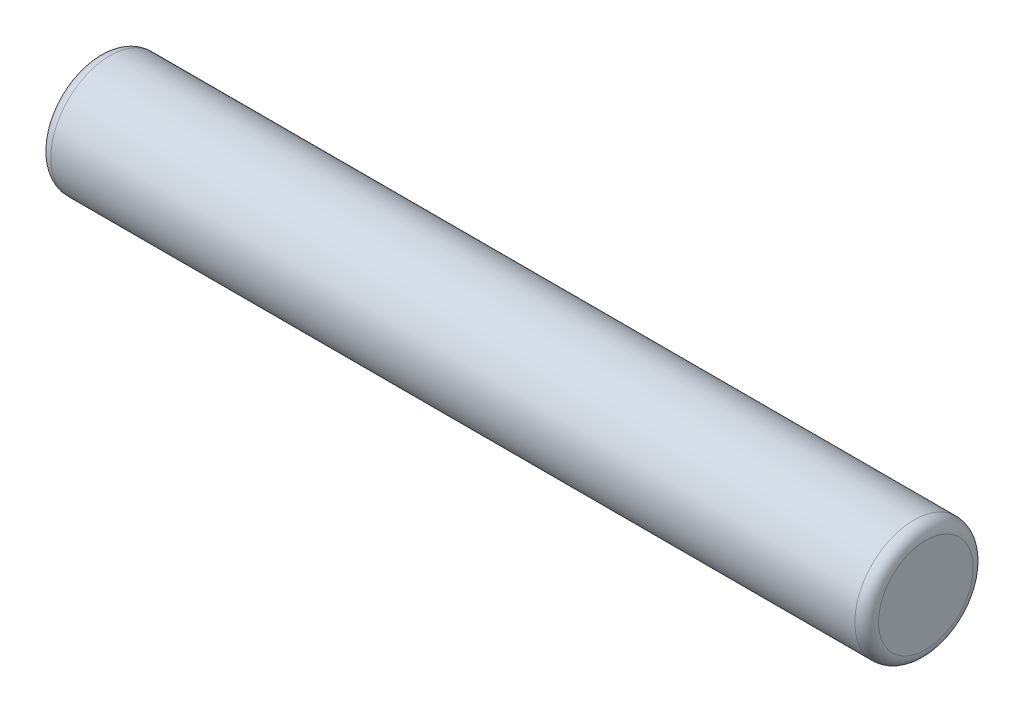
from build123d import *

# Parameters (mm, degrees)
SKIZZE1_R                       = 5
AUFSATZ_LINEAR_AUSTRAGEN1_DEPTH = 70
VERRUNDUNG3_R                   = 1


with BuildPart() as part:
    # Skizze1 → Aufsatz-Linear austragen1 (new body)
    with BuildSketch(Plane(origin=(0, 0, 0), x_dir=(0, 0, -1), z_dir=(1, 0, 0))):
        Circle(SKIZZE1_R)
    extrude(amount=AUFSATZ_LINEAR_AUSTRAGEN1_DEPTH)

    # Verrundung3
    verrundung3_edges = [part.edges().sort_by_distance(p)[0] for p in [
        (0, 0, 5),
        (70, 0, 5),
    ]]
    fillet(verrundung3_edges, radius=VERRUNDUNG3_R)


solid = part.part
